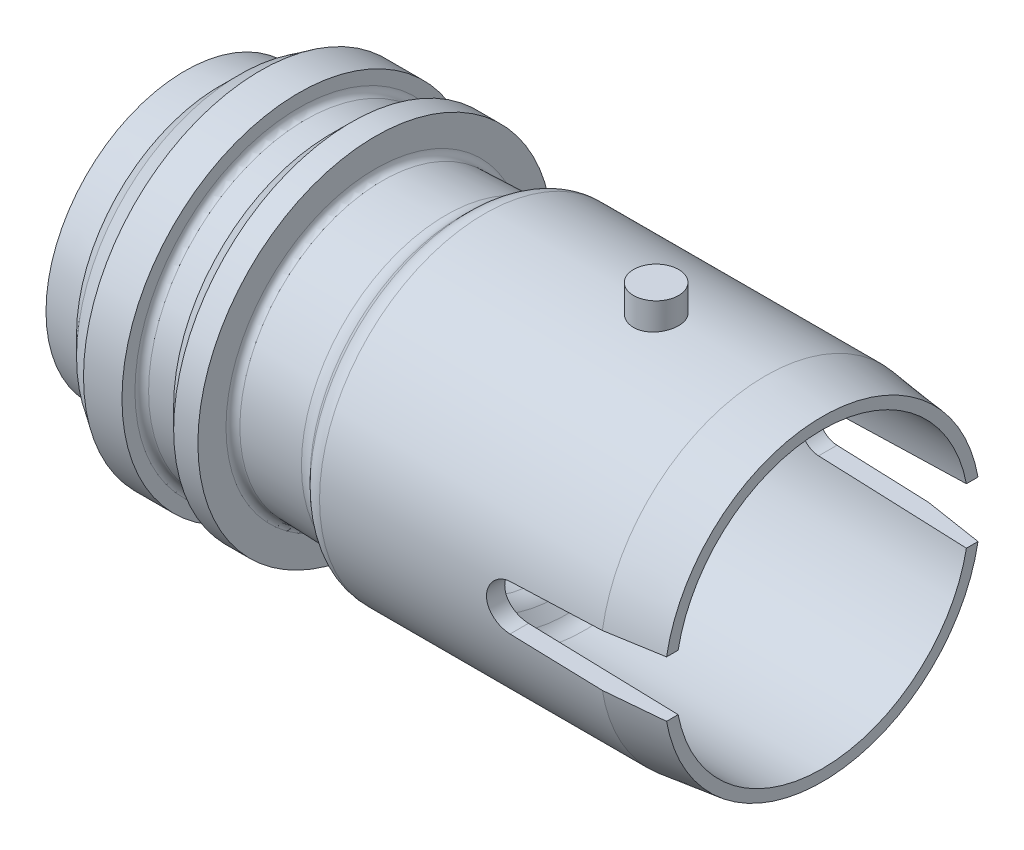
from build123d import *

# Parameters (mm, degrees)
CUT_EXTRUDE3_DEPTH       = 50.352144442
CUT_EXTRUDE3_DEPTH_BACK  = 50.352144442
BOSS_EXTRUDE1_REACH      = 63.121
BOSS_EXTRUDE1_END_RADIUS = 18.415
SKETCH3_R                = 2.5146
FILLET1_R                = 0.762
CHAMFER1_SIZE            = 2.794
CHAMFER1_SIZE_2          = 2.888956472
FILLET3_R                = 2.54


with BuildPart() as part:
    # Sketch1 → Revolve1 (revolve)
    with BuildSketch(Plane.XY, mode=Mode.PRIVATE) as revolve1_sk:
        Polygon((-40.64, 13.7795), (0, 13.7795), (0, 16.383), (30.48, 16.383), (30.48, 17.653), (24.13, 18.415), (-7.62, 18.415), (-7.62, 16.256), (-19.3929, 15.875), (-19.3929, 19.0373), (-19.3929, 19.7993), (-22.098, 19.7993), (-24.384, 17.5133), (-27.94, 17.5133), (-27.94, 19.7231), (-32.234028859, 19.7231), (-34.544, 18.188619171), (-36.724705389, 16.007913782), (-40.64, 15.500375591), (-40.64, 14.732), align=None)
    revolve(revolve1_sk.sketch.rotate(Axis((-11.776127049, 0, 0), (1, 0, 0)), 90), axis=Axis((-11.776127049, 0, 0), (1, 0, 0)))

    # Sketch2 → Cut-Extrude3 (cut, two sides: drawn at the far end of the back side and taken through both)
    with BuildSketch(Plane.XY.offset(-CUT_EXTRUDE3_DEPTH_BACK)):
        with BuildLine():
            Line((13.882361942, 2.538487654), (30.48, 3.1115))
            Line((30.48, 3.1115), (30.48, -3.1115))
            Line((30.48, -3.1115), (13.882361942, -2.538487654))
            ThreePointArc((13.882361942, -2.538487654), (11.43, 0), (13.882361942, 2.538487654))
        make_face()
    extrude(amount=CUT_EXTRUDE3_DEPTH + CUT_EXTRUDE3_DEPTH_BACK, mode=Mode.SUBTRACT)

    # Boss-Extrude1: up to this cylinder (the profile starts outside it)
    boss_extrude1_end = Plane(origin=(11.938, 0, 0), z_dir=(-1, 0, 0)) * Cylinder(BOSS_EXTRUDE1_END_RADIUS, 164.072, mode=Mode.PRIVATE)
    # Sketch3 → Boss-Extrude1 (add, up to the surface)
    with BuildSketch(Plane(origin=(0, 21.336, 0), x_dir=(1, 0, 0), z_dir=(0, 1, 0)), mode=Mode.PRIVATE) as boss_extrude1_sk1:
        with Locations(Location((11.938, 0, 0), (0, 0, 270))):
            Circle(SKETCH3_R)
    boss_extrude1_tool1 = extrude(boss_extrude1_sk1.sketch, amount=-BOSS_EXTRUDE1_REACH, mode=Mode.PRIVATE) - boss_extrude1_end
    boss_extrude1 = boss_extrude1_tool1.solids().sort_by_distance((11.938, 21.336, 0))[0]
    add(boss_extrude1)

    # Mirror1: Boss-Extrude1 across plane
    add(boss_extrude1.mirror(Plane.ZX))

    # Fillet1
    fillet1_edges = [part.edges().sort_by_distance(p)[0] for p in [
        (-27.94, 0, -17.5133),
        (-19.3929, 0, -15.875),
    ]]
    fillet(fillet1_edges, radius=FILLET1_R)

    # Chamfer1
    # the kernel refuses this chamfer: 2.888956472, 2.794 mm, written as the material it adds along each edge
    with BuildSketch(Plane(origin=(0, 0, 0), x_dir=(0, 0, 1), z_dir=(0, 1, 0))) as chamfer1_piece_1_section:
        Polygon((16.383 - CHAMFER1_SIZE, 0), (16.383, CHAMFER1_SIZE), (16.383, 0), align=None)
    chamfer1_piece_1 = revolve(axis=Axis((0, 0, 0), (1, 0, 0)), mode=Mode.PRIVATE)
    chamfer1_piece_1 = chamfer1_piece_1 - Plane(origin=(1.479100002, 0, 0), x_dir=(0, 0, 1), z_dir=(1, 0, 0)) * Cylinder(13.7795, 66, mode=Mode.PRIVATE)
    add(chamfer1_piece_1)
    with BuildSketch(Plane(origin=(-7.62, 0, 0), x_dir=(0, 0, 1), z_dir=(0, 1, 0))) as chamfer1_piece_2_section:
        Polygon((16.256 - CHAMFER1_SIZE_2 * 0.0323455257839, -CHAMFER1_SIZE_2 * 0.999476746721), (16.256 + CHAMFER1_SIZE, 0), (16.256, 0), align=None)
    chamfer1_piece_2 = revolve(axis=Axis((-7.62, 0, 0), (1, 0, 0)), mode=Mode.PRIVATE)
    chamfer1_piece_2 = chamfer1_piece_2 & Plane(origin=(-9.368047324, 0, 0), x_dir=(0, 0, 1), z_dir=(-1, 0, 0)) * Cylinder(18.415, 77, mode=Mode.PRIVATE)
    add(chamfer1_piece_2)

    # Fillet3
    fillet3_edges = [part.edges().sort_by_distance(p)[0] for p in [
        (-10.507444816, 0, -16.162555184),
        (2.794, 0, -16.383),
        (-8.255, 0, -18.415),
        (0.1905, 0, -13.7795),
    ]]
    fillet(fillet3_edges, radius=FILLET3_R)


solid = part.part
